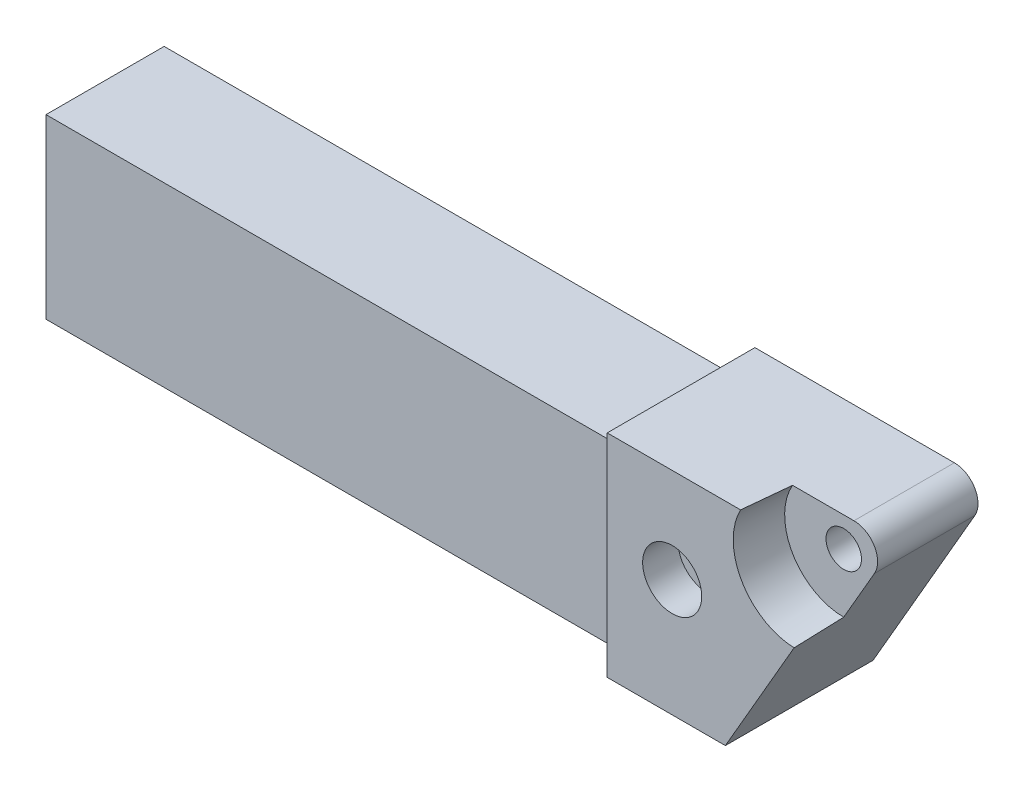
from build123d import *

# Parameters (mm, degrees)
SKETCH_1_W                = 100
SKETCH_1_H                = 30
EXTRUDE_1_DEPTH           = 20
EXTRUDE_2_DEPTH           = 5
EXTRUDE_2_DEPTH_BACK      = 20
FILLET_1_R                = 5
SKETCH_3_R                = 10
CUT_EXTRUDE_1_DEPTH       = 8
SKETCH_4_R                = 3
CUT_EXTRUDE_2_DEPTH       = 95.599814737
HOLE_WIZARD_1_D           = 5
HOLE_WIZARD_1_CBORE_D     = 10
HOLE_WIZARD_1_CBORE_DEPTH = 6
DRAFT_1_ANGLE             = 5
FILLET_2_R                = 4


with BuildPart() as part:
    # 草图1 → 凸台-拉伸1 (new body)
    with BuildSketch(Plane.XY):
        Rectangle(SKETCH_1_W, SKETCH_1_H)
    extrude(amount=EXTRUDE_1_DEPTH)

    # 草图2 → 凸台-拉伸2 (add, two sides: drawn at the far end of the back side and taken through both)
    with BuildSketch(Plane.XY.offset(20).offset(-EXTRUDE_2_DEPTH_BACK)):
        Polygon((50, -15), (70, -15), (90.695144291, 20.845041382), (50, 20.845041382), align=None)
    extrude(amount=EXTRUDE_2_DEPTH + EXTRUDE_2_DEPTH_BACK)

    # 圆角1
    fillet_1_edges = [part.edges().sort_by_distance(p)[0] for p in [
        (50, 15, 10),
        (50, 0, 20),
    ]]
    fillet(fillet_1_edges, radius=FILLET_1_R - 0.0001)  # a hair under: the kernel refuses the full size

    # 草图3 → 切除-拉伸1 (cut)
    with BuildSketch(Plane.XY.offset(25)):
        with Locations((82.034890253, 15.845041382)):
            Circle(SKETCH_3_R)
    extrude(amount=-CUT_EXTRUDE_1_DEPTH, mode=Mode.SUBTRACT)

    # 草图4 → 切除-拉伸2 (cut, through all)
    with BuildSketch(Plane.XY.offset(17)):
        with Locations((82.034890253, 15.845041382)):
            Circle(SKETCH_4_R)
    extrude(amount=-CUT_EXTRUDE_2_DEPTH, mode=Mode.SUBTRACT)

    # 孔1 (through all)
    with Locations(Plane(origin=(61, 4.845041382, 25), x_dir=(1, 0, 0), z_dir=(0, 0, 1))):
        with Locations((0, 0)):
            CounterBoreHole(HOLE_WIZARD_1_D / 2, HOLE_WIZARD_1_CBORE_D / 2, HOLE_WIZARD_1_CBORE_DEPTH)

    # 拔模1
    draft_1_faces = [part.faces().sort_by_distance(p)[0] for p in [
        (73.374636215, 10.845041382, 21),
    ]]
    draft(draft_1_faces, Plane(origin=(82.034890253, 15.845041382, 17), x_dir=(1, 0, 0), z_dir=(0, 0, 1)), DRAFT_1_ANGLE)

    # 圆角2
    fillet_2_edges = [part.edges().sort_by_distance(p)[0] for p in [
        (90.695144291, 20.845041382, 8.5),
    ]]
    fillet(fillet_2_edges, radius=FILLET_2_R)


solid = part.part
